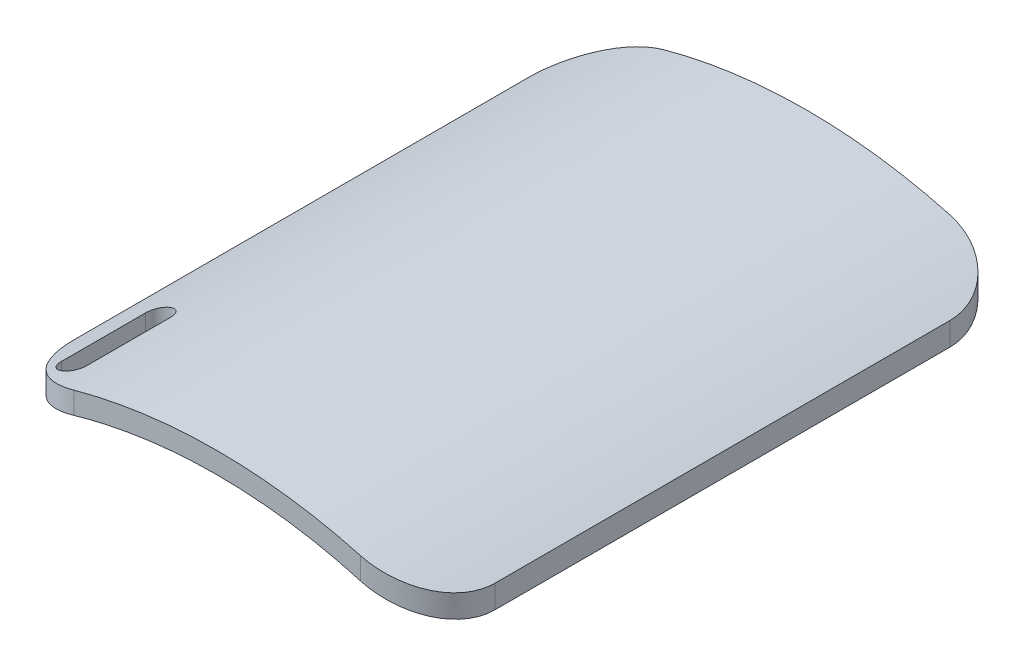
from build123d import *

# Parameters (mm, degrees)
BOSS_EXTRUDE1_START = -35
BOSS_EXTRUDE1_DEPTH = 70
CUT_EXTRUDE1_DEPTH  = 61.466933282
FILLET1_R           = 8


# Read off the part's stored shape, not the designer's step: Boss-Extrude1
with BuildPart() as part:
    # Boss-Extrude1 outline → Boss-Extrude1 (new body)
    with BuildSketch(Plane.XY.offset(BOSS_EXTRUDE1_START)):
        with BuildLine():
            Line((25, 34.641016151), (25, 37.382028889))
            add(Edge.make_bspline(
                [(25, 37.382028889), (23.499149868, 38.038900322), (20.42020332, 39.233525172), (12.247727699, 41.641473317), (0, 43.149082804), (-12.247727699, 41.641473317), (-20.42020332, 39.233525172), (-23.499149868, 38.038900322), (-25, 37.382028889)],
                knots=[1.070195568, 1.070195568, 1.070195568, 1.070195568, 1.168370339, 1.266545109, 1.570796327, 1.875047544, 1.973222315, 2.071397085, 2.071397085, 2.071397085, 2.071397085], degree=3))
            Line((-25, 37.382028889), (-25, 34.641016151))
            add(Edge.make_bspline(
                [(25, 34.641016151), (0, 46.188021535), (-25, 34.641016151)],
                knots=[1.047197551, 1.047197551, 1.047197551, 2.094395102, 2.094395102, 2.094395102], degree=2, weights=[1, 0.866025404, 1]))
        make_face()
    extrude(amount=BOSS_EXTRUDE1_DEPTH)

    # Sketch5 → Cut-Extrude1 (cut, through all)
    with BuildSketch(Plane(origin=(0, 0, 0), x_dir=(1, 0, 0), z_dir=(0, 1, 0))):
        with BuildLine():
            Line((-22.5, -31), (-22.5, -21))
            ThreePointArc((-22.5, -21), (-21, -19.5), (-19.5, -21))
            Line((-19.5, -21), (-19.5, -31))
            ThreePointArc((-19.5, -31), (-21, -32.5), (-22.5, -31))
        make_face()
    extrude(amount=CUT_EXTRUDE1_DEPTH, mode=Mode.SUBTRACT)

    # Fillet1
    # the kernel refuses this fillet: 8 mm, written as the material it takes off along each edge
    with BuildSketch(Plane(origin=(-25, 57.382028889, -35), x_dir=(1, 0, 0), z_dir=(0, -1, 0)), Plane(origin=(25, 14.641016151, 35), x_dir=(0, 0, -1), z_dir=(0, 1, 0))) as fillet1_piece_1:
        with BuildLine():
            CenterArc((FILLET1_R, FILLET1_R), FILLET1_R, 180, 90)
            Line((0, FILLET1_R), (0, 0))
            Line((0, 0), (FILLET1_R, 0))
        make_face()
    extrude(amount=42.741012738, mode=Mode.SUBTRACT)
    with BuildSketch(Plane(origin=(-25, 57.382028889, 35), x_dir=(1, 0, 0), z_dir=(0, -1, 0)), Plane(origin=(25, 14.641016151, -35), x_dir=(0, 0, 1), z_dir=(0, 1, 0))) as fillet1_piece_2:
        with BuildLine():
            CenterArc((FILLET1_R, -FILLET1_R), FILLET1_R, 90, 90)
            Line((0, -FILLET1_R), (0, 0))
            Line((0, 0), (FILLET1_R, 0))
        make_face()
    extrude(amount=42.741012738, mode=Mode.SUBTRACT)


solid = part.part
